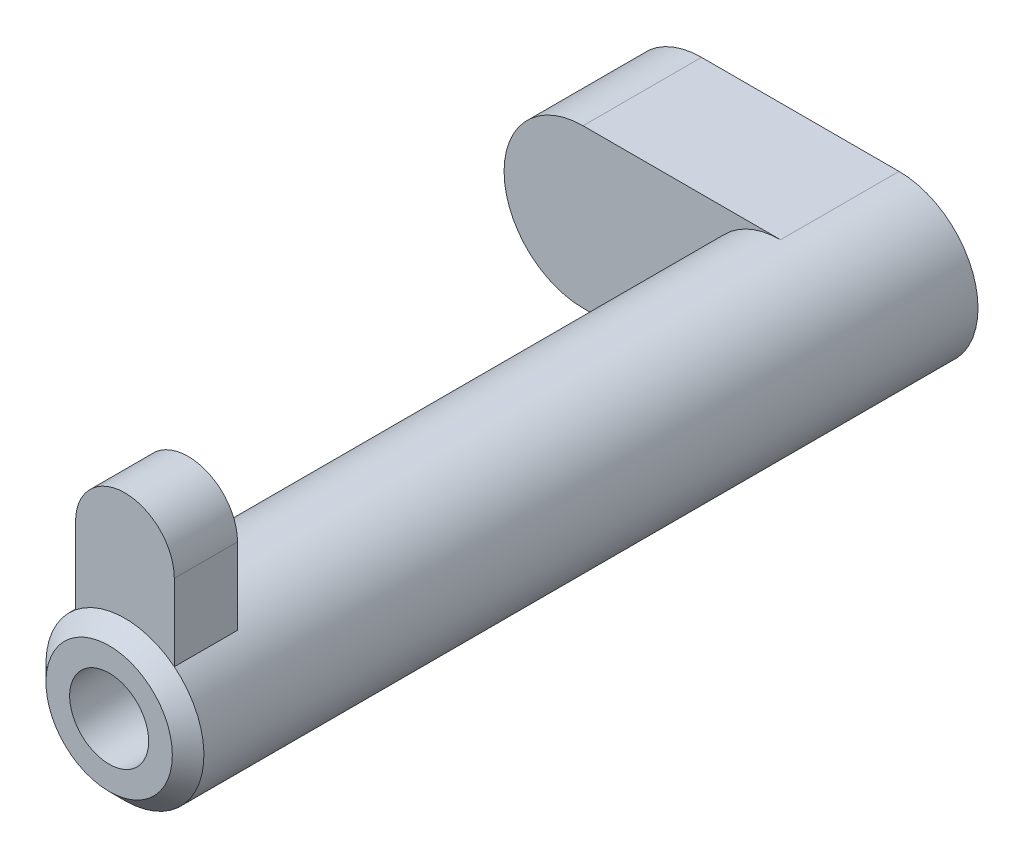
from build123d import *

# Parameters (mm, degrees)
AUFSATZ_LINEAR_AUSTRAGEN1_DEPTH = 3
SKIZZE2_R                       = 2
AUFSATZ_LINEAR_AUSTRAGEN2_DEPTH = 17
AUFSATZ_LINEAR_START            = 15
AUFSATZ_LINEAR_AUSTRAGEN3_DEPTH = 1.6
SCHNITT_LINEAR_AUSTRAGEN1_REACH = 23.715
SKIZZE4_R                       = 1
FASE1_SIZE                      = 0.4


with BuildPart() as part:
    # Skizze1 → Aufsatz-Linear austragen1 (new body)
    with BuildSketch(Plane.XY):
        with BuildLine():
            Line((0, 2), (-5, 2))
            ThreePointArc((-5, 2), (-7, 0), (-5, -2))
            Line((-5, -2), (0, -2))
            ThreePointArc((0, -2), (2, 0), (0, 2))
        make_face()
    extrude(amount=AUFSATZ_LINEAR_AUSTRAGEN1_DEPTH)

    # Skizze2 → Aufsatz-Linear austragen2 (add)
    with BuildSketch(Plane.XY.offset(3)):
        with Locations(Location((0, 0, 0), (0, 0, 90))):
            Circle(SKIZZE2_R)
    extrude(amount=AUFSATZ_LINEAR_AUSTRAGEN2_DEPTH)

    # Skizze3 → Aufsatz-Linear austragen3 (add)
    with BuildSketch(Plane.XY.offset(3).offset(AUFSATZ_LINEAR_START)):
        with BuildLine():
            Line((-1.25, 3.5), (-1.25, 1.5612495))
            ThreePointArc((-1.25, 1.5612495), (0, 2), (1.25, 1.5612495))
            Line((1.25, 1.5612495), (1.25, 3.5))
            ThreePointArc((1.25, 3.5), (0, 4.75), (-1.25, 3.5))
        make_face()
    extrude(amount=AUFSATZ_LINEAR_AUSTRAGEN3_DEPTH)

    # Skizze4 → Schnitt-Linear austragen1 (cut, up to next)
    with BuildSketch(Plane.XY.offset(20), mode=Mode.PRIVATE) as schnitt_linear_austragen1_sk1:
        Circle(SKIZZE4_R)
    schnitt_linear_austragen1_tool1 = extrude(schnitt_linear_austragen1_sk1.sketch, amount=-SCHNITT_LINEAR_AUSTRAGEN1_REACH, mode=Mode.PRIVATE) & part.part
    add(schnitt_linear_austragen1_tool1.solids().sort_by_distance((0, 0, 20))[0], mode=Mode.SUBTRACT)

    # Fase1
    fase1_edges = [part.edges().sort_by_distance(p)[0] for p in [
        (0, -2, 20),
    ]]
    chamfer(fase1_edges, length=FASE1_SIZE - 0.0001)  # a hair under: the kernel refuses the full size


solid = part.part
